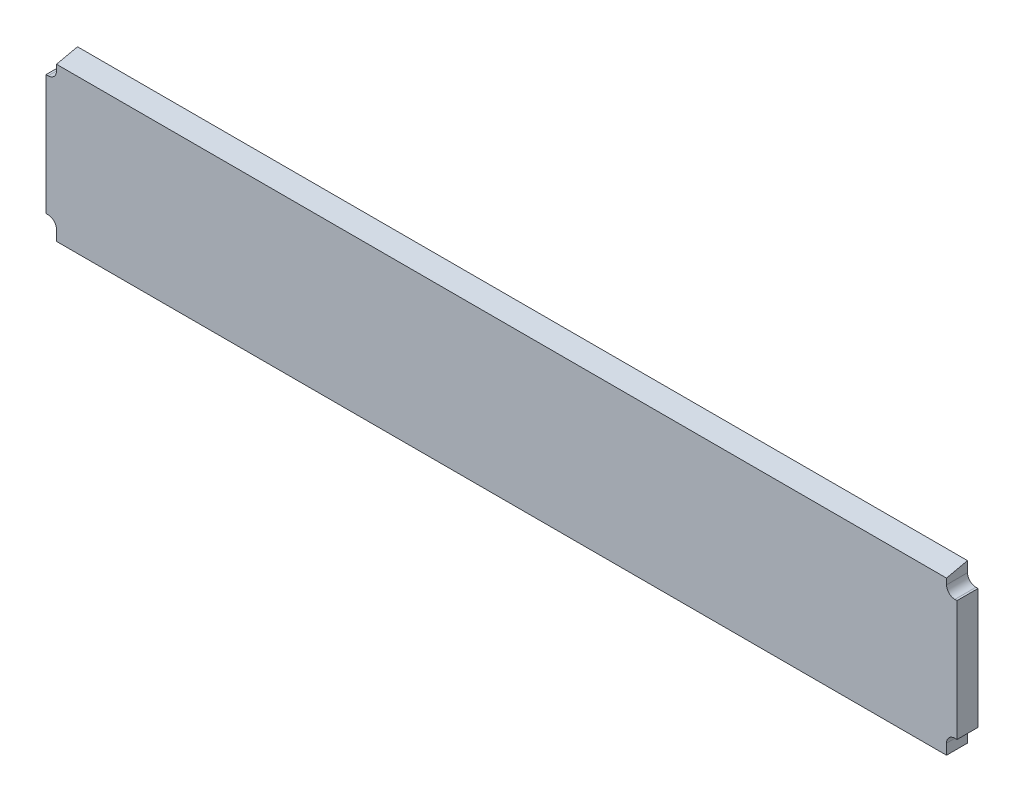
from build123d import *

# Parameters (mm, degrees)
BOSS_EXTRUDE1_DEPTH     = 15.875
FILLET1_R               = 6.35
CUT_EXTRUDE1_DEPTH      = 692.745678075
CUT_EXTRUDE1_DEPTH_BACK = 692.745678075


with BuildPart() as part:
    # Sketch1 → Boss-Extrude1 (new body)
    with BuildSketch(Plane.XY):
        Polygon((-336.55, -45.4914), (-336.55, -59.7789), (336.55, -59.7789), (336.55, -45.4914), (344.4875, -45.4914), (344.4875, 45.4914), (336.55, 45.4914), (336.55, 59.7789), (-336.55, 59.7789), (-336.55, 45.4914), (-344.4875, 45.4914), (-344.4875, -45.4914), align=None)
    extrude(amount=BOSS_EXTRUDE1_DEPTH)

    # Fillet1
    fillet1_edges = [part.edges().sort_by_distance(p)[0] for p in [
        (-336.55, -45.4914, 7.9375),
        (-336.55, 45.4914, 7.9375),
        (336.55, -45.4914, 7.9375),
        (336.55, 45.4914, 7.9375),
    ]]
    fillet(fillet1_edges, radius=FILLET1_R)

    # Sketch2 → Cut-Extrude1 (cut, two sides: drawn at the far end of the back side and taken through both)
    with BuildSketch(Plane(origin=(344.4875, 0, 0), x_dir=(0, 0, -1), z_dir=(1, 0, 0)).offset(-CUT_EXTRUDE1_DEPTH_BACK)):
        Polygon((0, 59.7789), (-15.875, 56.259497231), (-15.875, 59.7789), align=None)
    extrude(amount=CUT_EXTRUDE1_DEPTH + CUT_EXTRUDE1_DEPTH_BACK, mode=Mode.SUBTRACT)


solid = part.part
